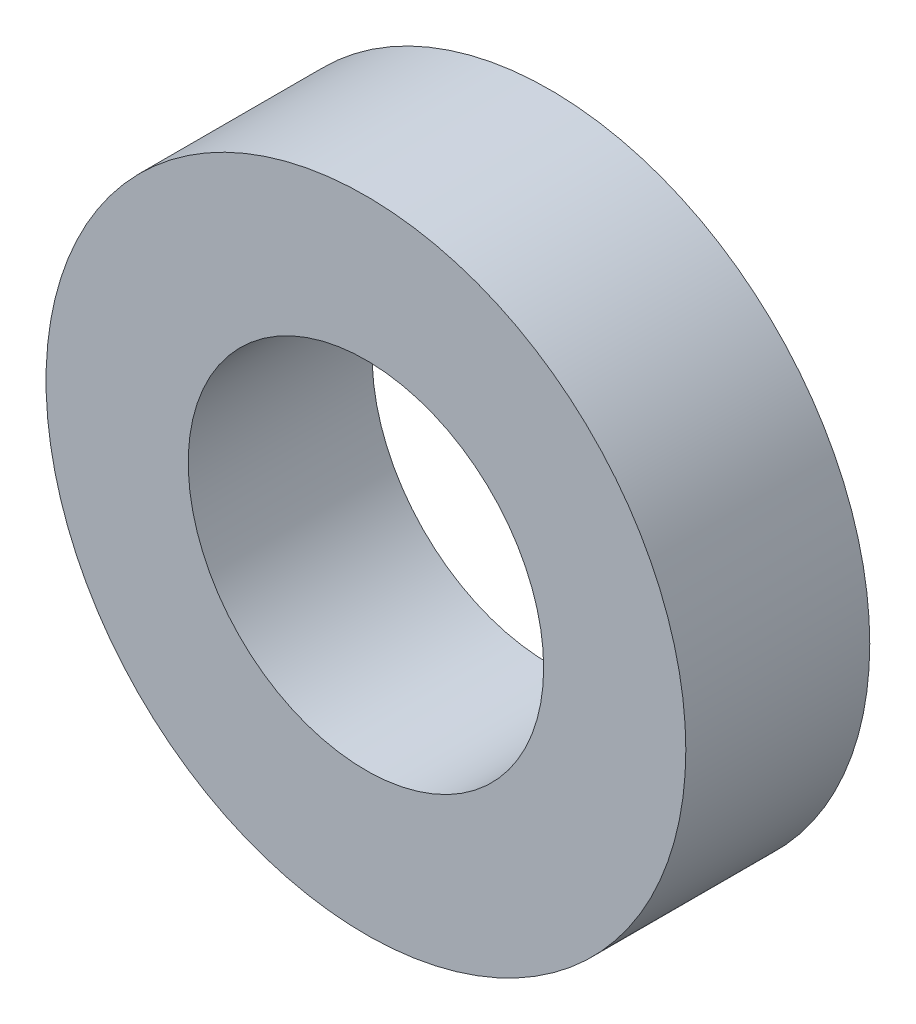
from build123d import *

# Parameters (mm, degrees)
SKETCH1_R           = 4.5
SKETCH1_R_2         = 2.5
BOSS_EXTRUDE1_DEPTH = 1.29375


with BuildPart() as part:
    # Sketch1 → Boss-Extrude1 (new, symmetric)
    with BuildSketch(Plane.XY):
        Circle(SKETCH1_R)
        Circle(SKETCH1_R_2, mode=Mode.SUBTRACT)
    extrude(amount=BOSS_EXTRUDE1_DEPTH, both=True)


solid = part.part
